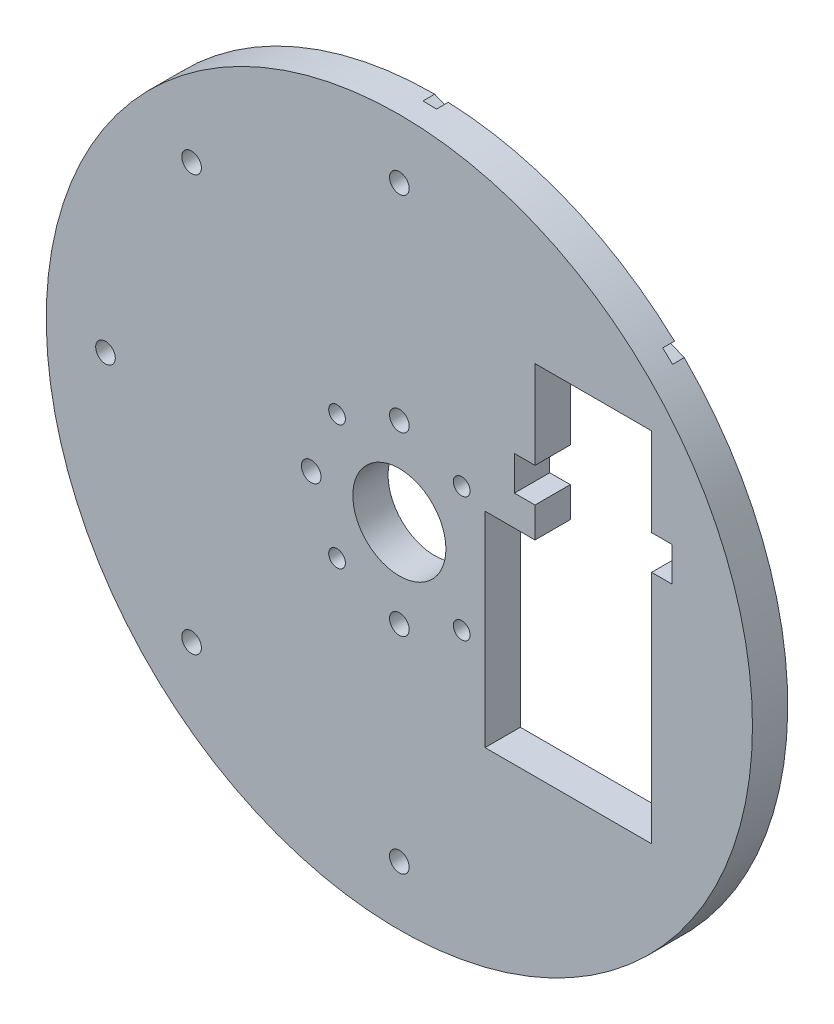
from build123d import *

# Parameters (mm, degrees)
SKETCH1_R              = 60
SKETCH1_R_2            = 8
SKETCH1_R_3            = 1.75
SKETCH1_R_4            = 1.5
BOSS_EXTRUDE1_DEPTH    = 6
CUT_EXTRUDE6_DEPTH     = 86.064681273
CUT_EXTRUDE7_DEPTH     = 2
MOVE_FACE2_OUTLINE_R   = 8
MOVE_FACE2_OUTLINE_R_2 = 7.92
MOVE_FACE2_OUTLINE_R_3 = 1.75
MOVE_FACE2_OUTLINE_R_4 = 1.67
MOVE_FACE2_OUTLINE_R_5 = 1.5
MOVE_FACE2_OUTLINE_R_6 = 1.42
MOVE_FACE2_DEPTH       = 6
MOVE_START             = 2
MOVE_FACE2_2_DEPTH     = 4


# Read off the part's stored shape, not the designer's step: Move Face2
with BuildPart() as part:
    # Sketch1 → Boss-Extrude1 (new body)
    with BuildSketch(Plane.XY):
        Circle(SKETCH1_R)
        Circle(SKETCH1_R_2, mode=Mode.SUBTRACT)
        with Locations((0, -15)):
            Circle(SKETCH1_R_3, mode=Mode.SUBTRACT)
        with Locations((10.606601718, -10.606601718)):
            Circle(SKETCH1_R_4, mode=Mode.SUBTRACT)
        with Locations((0, -50)):
            Circle(SKETCH1_R_3, mode=Mode.SUBTRACT)
        with Locations((-15, 0)):
            Circle(SKETCH1_R_3, mode=Mode.SUBTRACT)
        with Locations((-10.606601718, -10.606601718)):
            Circle(SKETCH1_R_4, mode=Mode.SUBTRACT)
        with Locations((0, 15)):
            Circle(SKETCH1_R_3, mode=Mode.SUBTRACT)
        with Locations((-10.606601718, 10.606601718)):
            Circle(SKETCH1_R_4, mode=Mode.SUBTRACT)
        with Locations((10.606601718, 10.606601718)):
            Circle(SKETCH1_R_4, mode=Mode.SUBTRACT)
        with Locations((-35.355339059, -35.355339059)):
            Circle(SKETCH1_R_3, mode=Mode.SUBTRACT)
        with Locations((-35.355339059, 35.355339059)):
            Circle(SKETCH1_R_3, mode=Mode.SUBTRACT)
        with Locations((-50, 0)):
            Circle(SKETCH1_R_3, mode=Mode.SUBTRACT)
        with Locations((0, 50)):
            Circle(SKETCH1_R_3, mode=Mode.SUBTRACT)
    extrude(amount=BOSS_EXTRUDE1_DEPTH)

    # Sketch7 → Cut-Extrude6 (cut, through all)
    with BuildSketch(Plane(origin=(0, 0, 0), x_dir=(-1, 0, 0), z_dir=(0, 0, -1))):
        Polygon((-43, -26), (-23, -26), (-14.5, -26), (-14.5, 9), (-23, 9), (-23, 14), (-19.5, 14), (-19.5, 20), (-23, 20), (-23, 35), (-43, 35), (-43, 20), (-46.5, 20), (-46.5, 14), (-43, 14), align=None)
    extrude(amount=-CUT_EXTRUDE6_DEPTH, mode=Mode.SUBTRACT)

    # Sketch8 → Cut-Extrude7 (cut)
    with BuildSketch(Plane(origin=(0, 0, 0), x_dir=(-1, 0, 0), z_dir=(0, 0, -1))):
        Polygon((-42.426406871, 42.426406871), (0, 60), (-0.316144007, 60.951441065), (-42.742550878, 43.377847936), align=None)
    extrude(amount=-CUT_EXTRUDE7_DEPTH, mode=Mode.SUBTRACT)

    # Move Face2 outline → Move Face2 (add)
    # profile 1 of 16: a face of its own
    with BuildSketch(Plane.XY):
        with BuildLine():
            ThreePointArc((0.01591808, 60.079997891), (-22.991620616, -55.506682313), (42.47171814, 42.494229705))
            Line((42.47171814, 42.494229705), (0.01591808, 60.079997891))
        make_face()
        with BuildLine():
            Line((0, 60), (42.426406871, 42.426406871))
            ThreePointArc((42.426406871, 42.426406871), (-22.961005942, -55.432771951), (0, 60))
        make_face(mode=Mode.SUBTRACT)
    # profile 2 of 16: a face of its own
    with BuildSketch(Plane.XY):
        with BuildLine():
            ThreePointArc((40.811514416, 44.091118052), (22.991620617, 55.506682313), (2.319029971, 60.035227159))
            Line((2.319029971, 60.035227159), (40.811514416, 44.091118052))
        make_face()
        with BuildLine():
            ThreePointArc((2.767270729, 59.936151134), (22.961005942, 55.432771951), (40.424503007, 44.338014803))
            Line((40.424503007, 44.338014803), (2.767270729, 59.936151134))
        make_face(mode=Mode.SUBTRACT)
    # profile 3 of 16: a face of its own
    with BuildSketch(Plane.XY):
        Circle(MOVE_FACE2_OUTLINE_R)
        Circle(MOVE_FACE2_OUTLINE_R_2, mode=Mode.SUBTRACT)
    # profile 4 of 16: a face of its own
    with BuildSketch(Plane.XY):
        with Locations((0, -15)):
            Circle(MOVE_FACE2_OUTLINE_R_3)
        with Locations((0, -15)):
            Circle(MOVE_FACE2_OUTLINE_R_4, mode=Mode.SUBTRACT)
    # profile 5 of 16: a face of its own
    with BuildSketch(Plane.XY):
        with Locations((10.606601718, -10.606601718)):
            Circle(MOVE_FACE2_OUTLINE_R_5)
        with Locations((10.606601718, -10.606601718)):
            Circle(MOVE_FACE2_OUTLINE_R_6, mode=Mode.SUBTRACT)
    # profile 6 of 16: a face of its own
    with BuildSketch(Plane.XY):
        with Locations((0, -50)):
            Circle(MOVE_FACE2_OUTLINE_R_3)
        with Locations((0, -50)):
            Circle(MOVE_FACE2_OUTLINE_R_4, mode=Mode.SUBTRACT)
    # profile 7 of 16: a face of its own
    with BuildSketch(Plane.XY):
        with Locations((-35.355339059, -35.355339059)):
            Circle(MOVE_FACE2_OUTLINE_R_3)
        with Locations((-35.355339059, -35.355339059)):
            Circle(MOVE_FACE2_OUTLINE_R_4, mode=Mode.SUBTRACT)
    # profile 8 of 16: a face of its own
    with BuildSketch(Plane.XY):
        with Locations((-15, 0)):
            Circle(MOVE_FACE2_OUTLINE_R_3)
        with Locations((-15, 0)):
            Circle(MOVE_FACE2_OUTLINE_R_4, mode=Mode.SUBTRACT)
    # profile 9 of 16: a face of its own
    with BuildSketch(Plane.XY):
        with Locations((-10.606601718, -10.606601718)):
            Circle(MOVE_FACE2_OUTLINE_R_5)
        with Locations((-10.606601718, -10.606601718)):
            Circle(MOVE_FACE2_OUTLINE_R_6, mode=Mode.SUBTRACT)
    # profile 10 of 16: a face of its own
    with BuildSketch(Plane.XY):
        with Locations((0, 15)):
            Circle(MOVE_FACE2_OUTLINE_R_3)
        with Locations((0, 15)):
            Circle(MOVE_FACE2_OUTLINE_R_4, mode=Mode.SUBTRACT)
    # profile 11 of 16: a face of its own
    with BuildSketch(Plane.XY):
        with Locations((-10.606601718, 10.606601718)):
            Circle(MOVE_FACE2_OUTLINE_R_5)
        with Locations((-10.606601718, 10.606601718)):
            Circle(MOVE_FACE2_OUTLINE_R_6, mode=Mode.SUBTRACT)
    # profile 12 of 16: a face of its own
    with BuildSketch(Plane.XY):
        with Locations((10.606601718, 10.606601718)):
            Circle(MOVE_FACE2_OUTLINE_R_5)
        with Locations((10.606601718, 10.606601718)):
            Circle(MOVE_FACE2_OUTLINE_R_6, mode=Mode.SUBTRACT)
    # profile 13 of 16: a face of its own
    with BuildSketch(Plane.XY):
        with Locations((-50, 0)):
            Circle(MOVE_FACE2_OUTLINE_R_3)
        with Locations((-50, 0)):
            Circle(MOVE_FACE2_OUTLINE_R_4, mode=Mode.SUBTRACT)
    # profile 14 of 16: a face of its own
    with BuildSketch(Plane.XY):
        with Locations((-35.355339059, 35.355339059)):
            Circle(MOVE_FACE2_OUTLINE_R_3)
        with Locations((-35.355339059, 35.355339059)):
            Circle(MOVE_FACE2_OUTLINE_R_4, mode=Mode.SUBTRACT)
    # profile 15 of 16: a face of its own
    with BuildSketch(Plane.XY):
        with Locations((0, 50)):
            Circle(MOVE_FACE2_OUTLINE_R_3)
        with Locations((0, 50)):
            Circle(MOVE_FACE2_OUTLINE_R_4, mode=Mode.SUBTRACT)
    # profile 16 of 16: a face of its own
    with BuildSketch(Plane.XY):
        Polygon((14.5, -26), (43, -26), (43, 14), (46.5, 14), (46.5, 20), (43, 20), (43, 35), (23, 35), (23, 20), (19.5, 20), (19.5, 14), (23, 14), (23, 9), (14.5, 9), align=None)
        Polygon((42.92, 14.08), (42.92, -25.92), (14.58, -25.92), (14.58, 8.92), (23.08, 8.92), (23.08, 14.08), (19.58, 14.08), (19.58, 19.92), (23.08, 19.92), (23.08, 34.92), (42.92, 34.92), (42.92, 19.92), (46.42, 19.92), (46.42, 14.08), align=None, mode=Mode.SUBTRACT)
    extrude(amount=MOVE_FACE2_DEPTH)

    # Move Face2 2 outline → Move Face2 2 (add)
    with BuildSketch(Plane.XY.offset(MOVE_START)):
        with BuildLine():
            Line((42.277699454, 42.574594876), (42.47171814, 42.494229705))
            ThreePointArc((42.47171814, 42.494229705), (41.649270334, 43.300631412), (40.811514416, 44.091118052))
            Line((40.811514416, 44.091118052), (40.597304781, 44.179846588))
            ThreePointArc((40.597304781, 44.179846588), (41.44527464, 43.385357092), (42.277699454, 42.574594876))
        make_face()
        with BuildLine():
            ThreePointArc((2.319029971, 60.035227159), (1.167688616, 60.068651585), (0.01591808, 60.079997891))
            Line((0.01591808, 60.079997891), (0.209936765, 59.99963272))
            ThreePointArc((0.209936765, 59.99963272), (1.371845458, 59.98431495), (2.533239607, 59.946498622))
            Line((2.533239607, 59.946498622), (2.319029971, 60.035227159))
        make_face()
    extrude(amount=MOVE_FACE2_2_DEPTH)


solid = part.part
